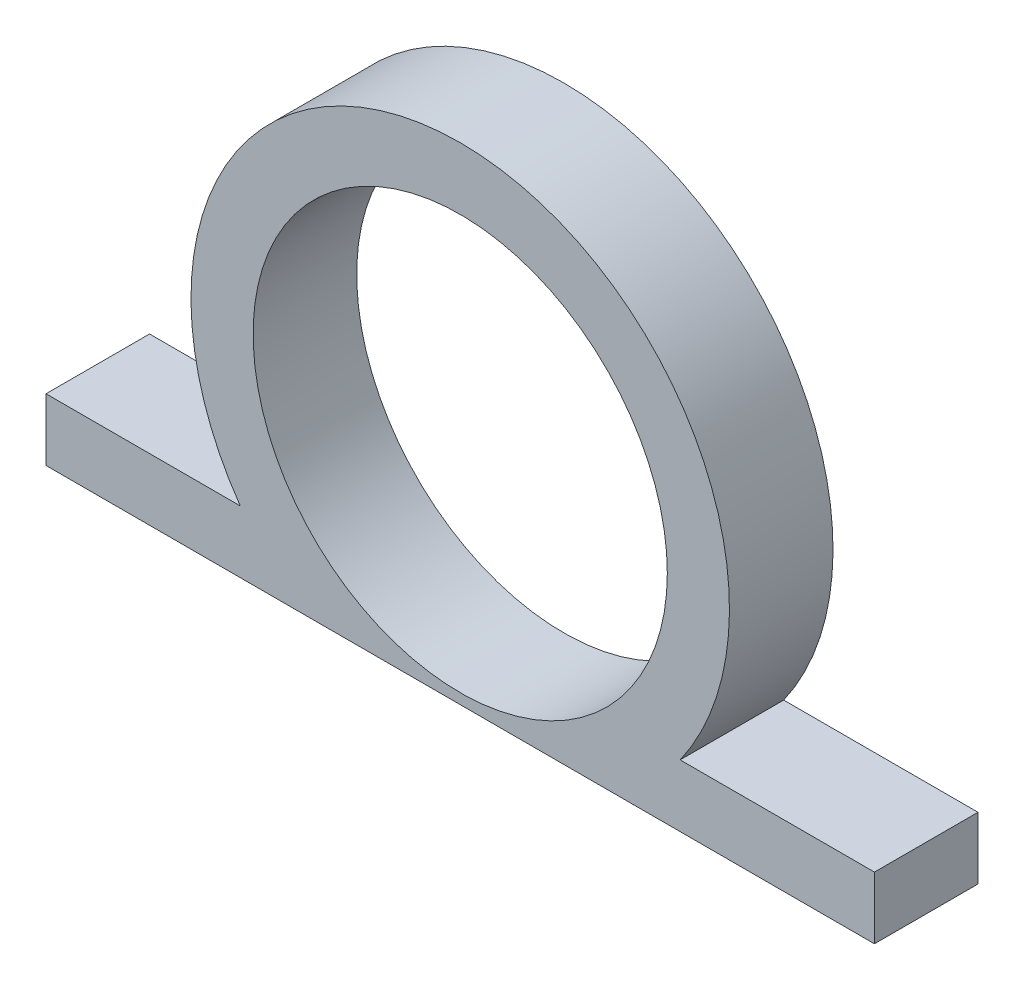
from build123d import *

# Parameters (mm, degrees)
SKETCH1_R           = 10
BOSS_EXTRUDE1_DEPTH = 5


with BuildPart() as part:
    # Sketch1 → Boss-Extrude1 (new body)
    with BuildSketch(Plane.XY):
        with BuildLine():
            Line((-20, -7.5), (-10.618380291, -7.5))
            ThreePointArc((-10.618380291, -7.5), (0, 13), (10.618380291, -7.5))
            Line((10.618380291, -7.5), (20, -7.5))
            Line((20, -7.5), (20, -10.5))
            Line((20, -10.5), (-20, -10.5))
            Line((-20, -10.5), (-20, -7.5))
        make_face()
        Circle(SKETCH1_R, mode=Mode.SUBTRACT)
    extrude(amount=BOSS_EXTRUDE1_DEPTH)


solid = part.part
